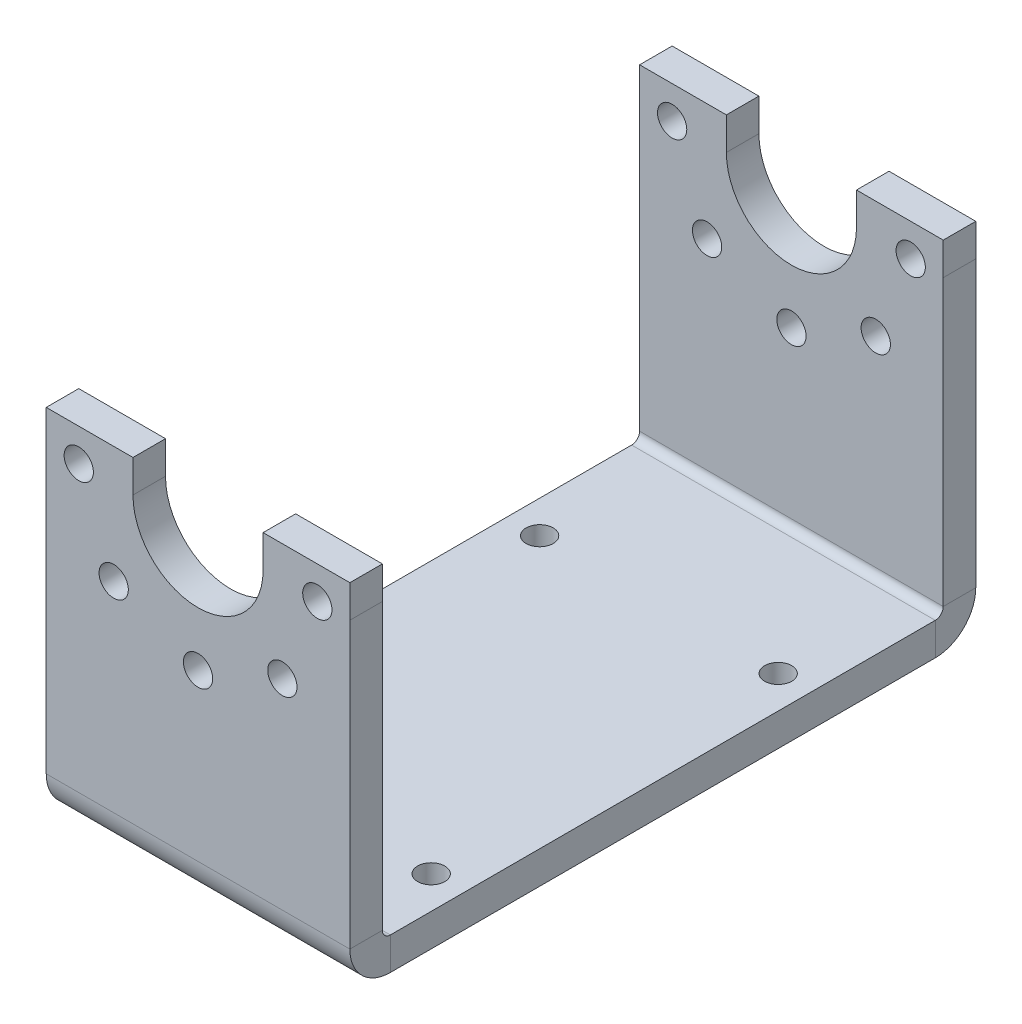
from build123d import *

# Parameters (mm, degrees)
SKETCH_1_W             = 28
SKETCH_1_H             = 160
SKETCH_1_R             = 1.25
SM_BASE_FLANGE_1_DEPTH = 3
OTHER_START            = -14
OTHER_1_DEPTH          = 28
OTHER_1_2_DEPTH        = 28
SKETCH_7_R             = 1.35
CUT_EXTRUDE_1_DEPTH    = 81.582164958


# Read off the part's stored shape, not the designer's step: 绘制的折弯1
# Sheet-metal steps are written as plain solids
with BuildPart() as part:
    # Sketch 1 → 基体-法兰1 (new body)
    with BuildSketch(Plane(origin=(0, 0, 0), x_dir=(1, 0, 0), z_dir=(0, 1, 0))):
        Rectangle(SKETCH_1_W, SKETCH_1_H)
        with Locations(Location((-11, -16, 0), (0, 0, 90))):
            Circle(SKETCH_1_R, mode=Mode.SUBTRACT)
        with Locations(Location((11, -16, 0), (0, 0, 270))):
            Circle(SKETCH_1_R, mode=Mode.SUBTRACT)
        with Locations(Location((11, 16, 0), (0, 0, 90))):
            Circle(SKETCH_1_R, mode=Mode.SUBTRACT)
        with Locations(Location((-11, 16, 0), (0, 0, 270))):
            Circle(SKETCH_1_R, mode=Mode.SUBTRACT)
    extrude(amount=-SM_BASE_FLANGE_1_DEPTH)

    # Other 1 outline → Other 1 (cut)
    with BuildSketch(Plane.YZ.offset(OTHER_START)):
        with BuildLine():
            ThreePointArc((0, -31.146677222), (-2.154295979, -29.850867001), (-3, -27.4834))
            Line((-3, -27.4834), (-3, -80))
            Line((-3, -80), (0, -80))
            Line((0, -80), (0, -31.146677222))
        make_face()
        with BuildLine():
            Line((-3, 80), (-3, 22.7634))
            ThreePointArc((-3, 22.7634), (-2.154295979, 25.130867001), (0, 26.426677222))
            Line((0, 26.426677222), (0, 80))
            Line((0, 80), (-3, 80))
        make_face()
    extrude(amount=OTHER_1_DEPTH, mode=Mode.SUBTRACT)

    # Other 1 2 outline → Other 1 2 (add)
    with BuildSketch(Plane.YZ.offset(OTHER_START)):
        with BuildLine():
            Line((0, -27.4834), (0, -31.146677222))
            ThreePointArc((0, -31.146677222), (0.36647982, -31.201624121), (0.7366, -31.22))
            Line((0.7366, -31.22), (49.739956935, -31.22))
            Line((49.739956935, -31.22), (49.739956935, -28.22))
            Line((49.739956935, -28.22), (0.7366, -28.22))
            ThreePointArc((0.7366, -28.22), (0.215745145, -28.004254855), (0, -27.4834))
        make_face()
        with BuildLine():
            ThreePointArc((0.7366, 26.5), (0.36647982, 26.481624121), (0, 26.426677222))
            Line((0, 26.426677222), (0, 22.7634))
            ThreePointArc((0, 22.7634), (0.215745145, 23.284254855), (0.7366, 23.5))
            Line((0.7366, 23.5), (54.459956935, 23.5))
            Line((54.459956935, 23.5), (54.459956935, 26.5))
            Line((54.459956935, 26.5), (0.7366, 26.5))
        make_face()
    extrude(amount=OTHER_1_2_DEPTH)

    # Sketch 7 → 切除-拉伸1 (cut, through all)
    with BuildSketch(Plane(origin=(0, 0, -31.22), x_dir=(-1, 0, 0), z_dir=(0, 0, -1))):
        with Locations(Location((11, 27, 0), (0, 0, 90))):
            Circle(SKETCH_7_R)
        with Locations(Location((7.778174593, 19.221825407, 0), (0, 0, 90))):
            Circle(SKETCH_7_R)
        with Locations(Location((0, 16, 0), (0, 0, 90))):
            Circle(SKETCH_7_R)
        with Locations(Location((-7.778174593, 19.221825407, 0), (0, 0, 90))):
            Circle(SKETCH_7_R)
        with Locations(Location((-11, 27, 0), (0, 0, 90))):
            Circle(SKETCH_7_R)
        with BuildLine():
            Line((-14, 27), (-32.703539992, 27))
            Line((-32.703539992, 27), (-27.737483214, 57.366036836))
            Line((-27.737483214, 57.366036836), (24.538070134, 57.366036836))
            Line((24.538070134, 57.366036836), (24.538070134, 27))
            Line((24.538070134, 27), (14, 27))
            Line((14, 27), (14, 30))
            Line((14, 30), (6, 30))
            Line((6, 30), (6, 27))
            ThreePointArc((6, 27), (0, 21), (-6, 27))
            Line((-6, 27), (-6, 30))
            Line((-6, 30), (-14, 30))
            Line((-14, 30), (-14, 27))
        make_face()
    extrude(amount=-CUT_EXTRUDE_1_DEPTH, mode=Mode.SUBTRACT)


solid = part.part
